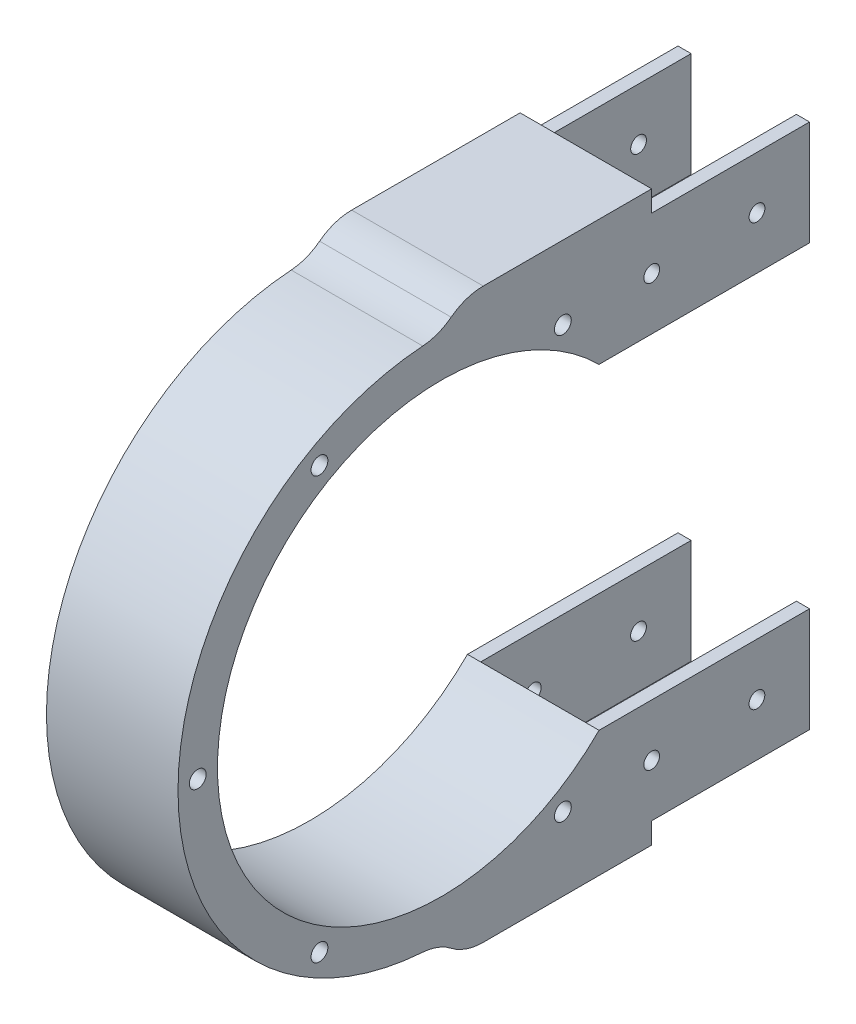
from build123d import *

# Parameters (mm, degrees)
SKETCH_1_R          = 1.6
EXTRUDE_1_DEPTH     = 25
SKETCH_2_W          = 2.5
SKETCH_2_H          = 19.896013553
EXTRUDE_2_DEPTH     = 40
SKETCH_3_R          = 1.5
CUT_EXTRUDE_1_DEPTH = 90.582364336
SKETCH_4_W          = 40
SKETCH_4_H          = 4
EXTRUDE_3_DEPTH     = 25
FILLET_4_R          = 10
FILLET_5_R          = 10


with BuildPart() as part:
    # 草图1 → 凸台-拉伸1 (new body)
    # profile 1 of 2: a face of its own
    with BuildSketch(Plane(origin=(0, 0, 0), x_dir=(0, 0, -1), z_dir=(1, 0, 0))):
        with BuildLine():
            ThreePointArc((-47.85, 0), (-46.25, 1.6), (-44.65, 0))
            Line((-44.65, 0), (-42.5, 0))
            ThreePointArc((-42.5, 0), (-16.298006013, 39.25079617), (30, 30.103986447))
            Line((30, 30.103986447), (30, 50))
            Line((30, 50), (0, 50))
            ThreePointArc((0, 50), (-35.355339059, 35.355339059), (-50, 0))
            Line((-50, 0), (-47.85, 0))
        make_face()
        with Locations((-23.125, 40.053674925)):
            Circle(SKETCH_1_R, mode=Mode.SUBTRACT)
        with Locations((23.125, 40.053674925)):
            Circle(SKETCH_1_R, mode=Mode.SUBTRACT)
    # profile 2 of 2: a face of its own
    with BuildSketch(Plane(origin=(0, 0, 0), x_dir=(0, 0, -1), z_dir=(1, 0, 0))):
        with BuildLine():
            Line((-42.5, 0), (-44.65, 0))
            ThreePointArc((-44.65, 0), (-46.25, -1.6), (-47.85, 0))
            Line((-47.85, 0), (-50, 0))
            ThreePointArc((-50, 0), (-35.355339059, -35.355339059), (0, -50))
            Line((0, -50), (30, -50))
            Line((30, -50), (30, -30.103986447))
            ThreePointArc((30, -30.103986447), (-16.298006013, -39.25079617), (-42.5, 0))
        make_face()
        with Locations((-23.125, -40.053674925)):
            Circle(SKETCH_1_R, mode=Mode.SUBTRACT)
        with Locations((23.125, -40.053674925)):
            Circle(SKETCH_1_R, mode=Mode.SUBTRACT)
    extrude(amount=EXTRUDE_1_DEPTH)

    # 草图2 → 凸台-拉伸2 (add)
    with BuildSketch(Plane(origin=(0, 0, -30), x_dir=(-1, 0, 0), z_dir=(0, 0, -1))):
        with Locations((-23.75, 40.051993223)):
            Rectangle(SKETCH_2_W, SKETCH_2_H)
        with Locations((-1.25, 40.051993223)):
            Rectangle(SKETCH_2_W, SKETCH_2_H)
        with Locations((-1.25, -40.051993223)):
            Rectangle(SKETCH_2_W, SKETCH_2_H)
        with Locations((-23.75, -40.051993223)):
            Rectangle(SKETCH_2_W, SKETCH_2_H)
    extrude(amount=EXTRUDE_2_DEPTH)

    # 草图3 → 切除-拉伸1 (cut, through all)
    with BuildSketch(Plane(origin=(25, 0, 0), x_dir=(0, 0, -1), z_dir=(1, 0, 0))):
        with Locations((60, -40.051993223)):
            Circle(SKETCH_3_R)
        with Locations((40, -40.051993223)):
            Circle(SKETCH_3_R)
        with Locations(Location((40.013969678, 40.055824633, 0), (0, 0, 270))):
            Circle(SKETCH_3_R)
        with Locations(Location((60.013968461, 40.048849195, 0), (0, 0, 270))):
            Circle(SKETCH_3_R)
    extrude(amount=-CUT_EXTRUDE_1_DEPTH, mode=Mode.SUBTRACT)

    # 草图4 → 凸台-拉伸3 (add)
    with BuildSketch(Plane(origin=(25, 0, 0), x_dir=(0, 0, -1), z_dir=(1, 0, 0))):
        with Locations((20, 52)):
            Rectangle(SKETCH_4_W, SKETCH_4_H)
        with Locations((20, -52)):
            Rectangle(SKETCH_4_W, SKETCH_4_H)
    extrude(amount=-EXTRUDE_3_DEPTH)

    # 圆角4
    # the kernel refuses this fillet: 10 mm, written as the material it takes off along each edge
    with BuildSketch(Plane(origin=(45, -54, 0), x_dir=(0, 0, -1), z_dir=(-1, 0, 0))) as fillet_4_piece_1:
        with BuildLine():
            CenterArc((8, -10), FILLET_4_R, 90, 53.130102354)
            Line((0, -4), (-0.16, -3.88))
            ThreePointArc((-0.16, -3.88), (-0.2, -2), (-0.2, 0))
            Line((-0.2, 0), (0, 0.2))
            Line((0, 0.2), (8, 0.2))
            Line((8, 0.2), (8, 0))
        make_face()
    extrude(amount=65, mode=Mode.SUBTRACT)
    with BuildSketch(Plane(origin=(45, 54, 0), x_dir=(0, 0, -1), z_dir=(-1, 0, 0))) as fillet_4_piece_2:
        with BuildLine():
            CenterArc((8, 10), FILLET_4_R, 216.869897646, 53.130102354)
            Line((0, 4), (-0.16, 3.88))
            ThreePointArc((-0.16, 3.88), (-0.2, 2), (-0.2, 0))
            Line((-0.2, 0), (0, -0.2))
            Line((0, -0.2), (8, -0.2))
            Line((8, -0.2), (8, 0))
        make_face()
    extrude(amount=65, mode=Mode.SUBTRACT)

    # 圆角5
    fillet_5_edges = [part.edges().sort_by_distance(p)[0] for p in [
        (12.5, -50, 0),
        (12.5, 50, 0),
    ]]
    fillet(fillet_5_edges, radius=FILLET_5_R)


solid = part.part
